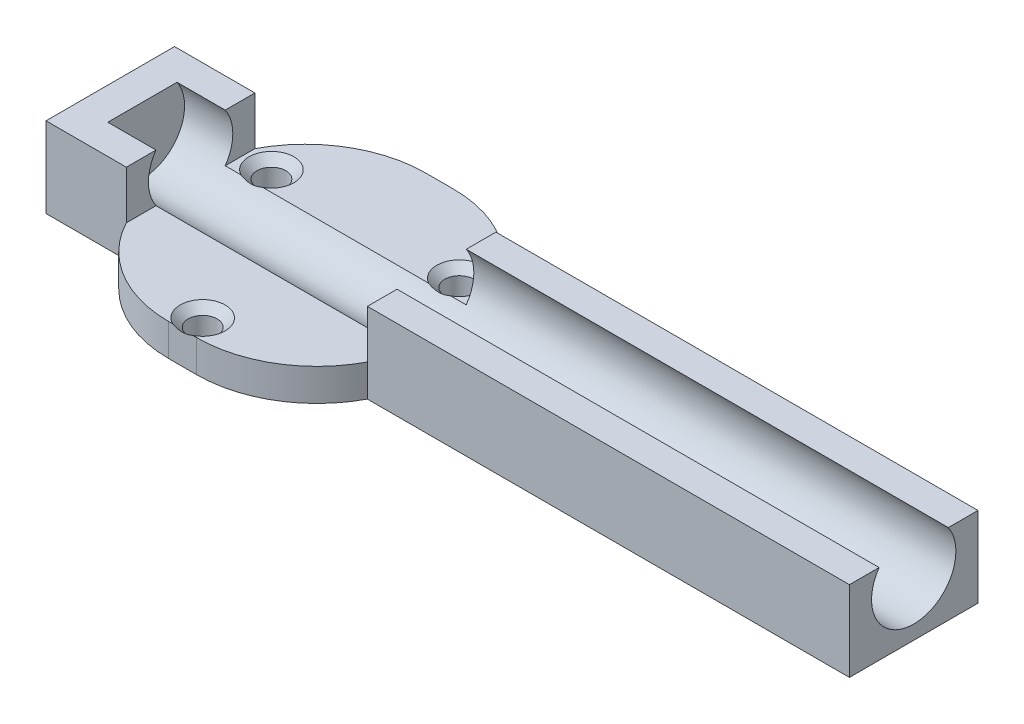
from build123d import *

# Parameters (mm, degrees)
EXTRUDE_2_DEPTH     = 4
SKETCH_7_W          = 100
SKETCH_7_H          = 16
EXTRUDE_3_DEPTH     = 6
SKETCH_8_R          = 5.25
CUT_EXTRUDE_3_DEPTH = 96
SKETCH_9_W          = 30
SKETCH_9_H          = 6
CUT_EXTRUDE_4_DEPTH = 94.680307429
SKETCH_10_R         = 1.8
CUT_EXTRUDE_5_DEPTH = 92.607859925
FILLET_3_R          = 15
CHAMFER_1_SIZE      = 1


with BuildPart() as part:
    # Эскиз6 → Бобышка-Вытянуть2 (new body)
    with BuildSketch(Plane(origin=(0, 0, 0), x_dir=(1, 0, 0), z_dir=(0, 1, 0))):
        Polygon((0, 16), (0, 8), (-10, 8), (-10, -8), (0, -8), (0, -16), (30, -16), (30, -8), (90, -8), (90, 8), (30, 8), (30, 16), align=None)
    extrude(amount=EXTRUDE_2_DEPTH)

    # Эскиз7 → Бобышка-Вытянуть3 (add)
    with BuildSketch(Plane(origin=(0, 4, 0), x_dir=(1, 0, 0), z_dir=(0, 1, 0))):
        with Locations((40, 0)):
            Rectangle(SKETCH_7_W, SKETCH_7_H)
    extrude(amount=EXTRUDE_3_DEPTH)

    # Эскиз8 → Вырез-Вытянуть3 (cut)
    with BuildSketch(Plane(origin=(90, 0, 0), x_dir=(0, 0, -1), z_dir=(1, 0, 0))):
        with Locations((0, 7)):
            Circle(SKETCH_8_R)
    extrude(amount=-CUT_EXTRUDE_3_DEPTH, mode=Mode.SUBTRACT)

    # Эскиз9 → Вырез-Вытянуть4 (cut, through all)
    with BuildSketch(Plane.XY.offset(8)):
        with Locations((15, 7)):
            Rectangle(SKETCH_9_W, SKETCH_9_H)
    extrude(amount=-CUT_EXTRUDE_4_DEPTH, mode=Mode.SUBTRACT)

    # Эскиз10 → Вырез-Вытянуть5 (cut, through all)
    with BuildSketch(Plane(origin=(0, 4, 0), x_dir=(1, 0, 0), z_dir=(0, 1, 0))):
        with Locations(Location((15, -13.5, 0), (0, 0, 270))):
            Circle(SKETCH_10_R)
        with Locations(Location((3.308657049, 6.75, 0), (0, 0, 270))):
            Circle(SKETCH_10_R)
        with Locations(Location((26.691342951, 6.75, 0), (0, 0, 270))):
            Circle(SKETCH_10_R)
    extrude(amount=-CUT_EXTRUDE_5_DEPTH, mode=Mode.SUBTRACT)

    # Скругление3
    # the kernel refuses this fillet: 15 mm, written as the material it takes off along each edge
    with BuildSketch(Plane(origin=(30, -33.166247904, -16), x_dir=(-1, 0, 0), z_dir=(0, 1, 0))) as fillet_3_piece_1:
        with BuildLine():
            CenterArc((13.266499161, 15), FILLET_3_R, 207.818139285, 62.181860715)
            Line((0, 8), (-0.265329983, 7.86))
            ThreePointArc((-0.265329983, 7.86), (-0.3, 4), (-0.3, 0))
            Line((-0.3, 0), (0, -0.3))
            Line((0, -0.3), (13.266499161, -0.3))
            Line((13.266499161, -0.3), (13.266499161, 0))
        make_face()
    extrude(amount=70.332495807, mode=Mode.SUBTRACT)
    with BuildSketch(Plane(origin=(0, -33.166247904, -16), x_dir=(0, 0, 1), z_dir=(0, 1, 0))) as fillet_3_piece_2:
        with BuildLine():
            CenterArc((15, 13.266499161), FILLET_3_R, 180, 62.181860715)
            Line((0, 13.266499161), (-0.3, 13.266499161))
            Line((-0.3, 13.266499161), (-0.3, 0))
            Line((-0.3, 0), (0, -0.3))
            ThreePointArc((0, -0.3), (4, -0.3), (7.86, -0.265329983))
            Line((7.86, -0.265329983), (8, 0))
        make_face()
    extrude(amount=70.332495807, mode=Mode.SUBTRACT)
    with BuildSketch(Plane(origin=(30, -33.166247904, 16), x_dir=(-1, 0, 0), z_dir=(0, 1, 0))) as fillet_3_piece_3:
        with BuildLine():
            CenterArc((13.266499161, -15), FILLET_3_R, 90, 62.181860715)
            Line((0, -8), (-0.265329983, -7.86))
            ThreePointArc((-0.265329983, -7.86), (-0.3, -4), (-0.3, 0))
            Line((-0.3, 0), (0, 0.3))
            Line((0, 0.3), (13.266499161, 0.3))
            Line((13.266499161, 0.3), (13.266499161, 0))
        make_face()
    extrude(amount=70.332495807, mode=Mode.SUBTRACT)
    with BuildSketch(Plane(origin=(0, -33.166247904, 16), x_dir=(0, 0, -1), z_dir=(0, 1, 0))) as fillet_3_piece_4:
        with BuildLine():
            CenterArc((15, -13.266499161), FILLET_3_R, 117.818139285, 62.181860715)
            Line((0, -13.266499161), (-0.3, -13.266499161))
            Line((-0.3, -13.266499161), (-0.3, 0))
            Line((-0.3, 0), (0, 0.3))
            ThreePointArc((0, 0.3), (4, 0.3), (7.86, 0.265329983))
            Line((7.86, 0.265329983), (8, 0))
        make_face()
    extrude(amount=70.332495807, mode=Mode.SUBTRACT)

    # Фаска1
    # the kernel refuses this chamfer: 1 mm, written as the material it takes off along each edge
    with BuildSketch(Plane(origin=(3.308657049, 4, -6.75), x_dir=(0, 0, 1), z_dir=(-1, 0, 0))) as chamfer_1_piece_1:
        Polygon((1.8, -CHAMFER_1_SIZE), (1.8 + CHAMFER_1_SIZE, 0), (1.8, 0), align=None)
    revolve(axis=Axis((3.308657049, 4, -6.75), (0, 1, 0)), mode=Mode.SUBTRACT)
    with BuildSketch(Plane(origin=(26.691342951, 4, -6.75), x_dir=(0, 0, 1), z_dir=(-1, 0, 0))) as chamfer_1_piece_2:
        Polygon((1.8, -CHAMFER_1_SIZE), (1.8 + CHAMFER_1_SIZE, 0), (1.8, 0), align=None)
    revolve(axis=Axis((26.691342951, 4, -6.75), (0, 1, 0)), mode=Mode.SUBTRACT)
    with BuildSketch(Plane(origin=(15, 4, 13.5), x_dir=(0, 0, 1), z_dir=(-1, 0, 0))) as chamfer_1_piece_3:
        Polygon((1.8, -CHAMFER_1_SIZE), (1.8 + CHAMFER_1_SIZE, 0), (1.8, 0), align=None)
    revolve(axis=Axis((15, 4, 13.5), (0, 1, 0)), mode=Mode.SUBTRACT)


solid = part.part
